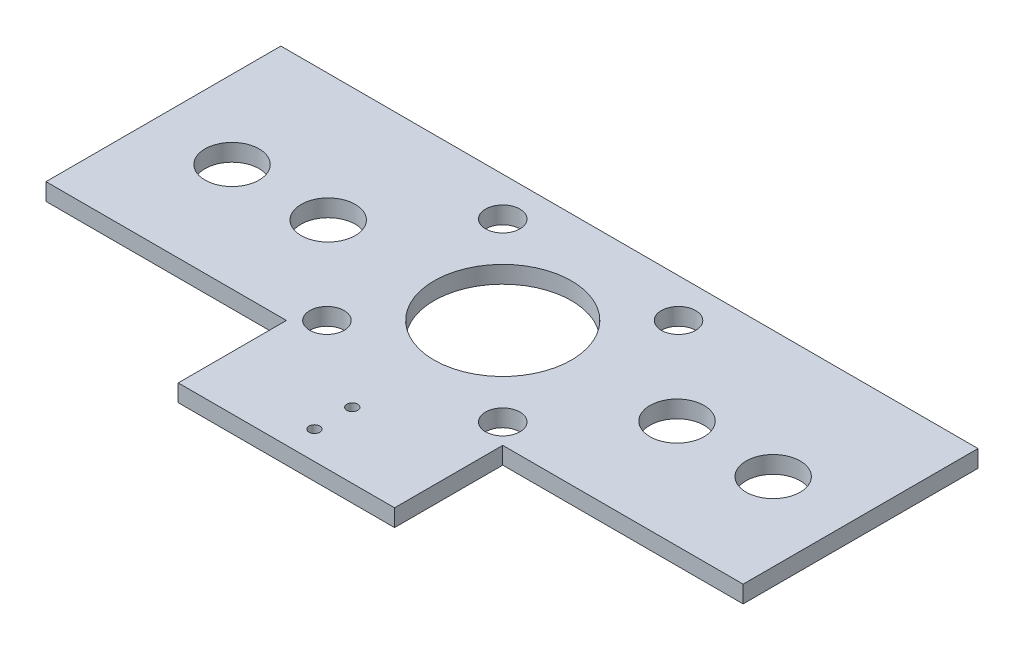
from build123d import *

# Parameters (mm, degrees)
PLATEOUTLINE_W      = 80
PLATEOUTLINE_H      = 40
BOSS_EXTRUDE1_DEPTH = 6.35
RAILGUIDES_R        = 6.35
CUT_EXTRUDE1_DEPTH  = 10
FUELGRAINMOUNTING_R = 25.4
CUT_EXTRUDE2_DEPTH  = 10
SKETCH2_R           = 2
CUT_EXTRUDE3_DEPTH  = 10
SKETCH5_R           = 10
CUT_EXTRUDE4_DEPTH  = 10


with BuildPart() as part:
    # plateOutline → Boss-Extrude1 (new body)
    with BuildSketch(Plane(origin=(0, 0, 0), x_dir=(1, 0, 0), z_dir=(0, 1, 0))):
        Polygon((-128.9, -40), (-40, -40), (40, -40), (128.9, -40), (128.9, 40), (128.9, 46.849926081), (-128.9, 46.849926081), (-128.9, 40), align=None)
        Polygon((-128.9, -40), (-40, -40), (40, -40), (128.9, -40), (128.9, 40), (128.9, 46.849926081), (-128.9, 46.849926081), (-128.9, 40), align=None)
        with Locations((0, -60)):
            Rectangle(PLATEOUTLINE_W, PLATEOUTLINE_H)
    extrude(amount=BOSS_EXTRUDE1_DEPTH)

    # railGuides → Cut-Extrude1 (cut)
    with BuildSketch(Plane(origin=(0, 0, 0), x_dir=(1, 0, 0), z_dir=(0, 1, 0))):
        with Locations((-32.5, 32.5)):
            Circle(RAILGUIDES_R)
        with Locations((32.5, 32.5)):
            Circle(RAILGUIDES_R)
        with Locations((32.5, -32.5)):
            Circle(RAILGUIDES_R)
        with Locations((-32.5, -32.5)):
            Circle(RAILGUIDES_R)
    extrude(amount=CUT_EXTRUDE1_DEPTH, mode=Mode.SUBTRACT)

    # FuelGrainMounting → Cut-Extrude2 (cut)
    with BuildSketch(Plane(origin=(0, 0, 0), x_dir=(1, 0, 0), z_dir=(0, 1, 0))):
        Circle(FUELGRAINMOUNTING_R)
    extrude(amount=CUT_EXTRUDE2_DEPTH, mode=Mode.SUBTRACT)

    # Sketch2 → Cut-Extrude3 (cut)
    with BuildSketch(Plane(origin=(0, 0, 0), x_dir=(1, 0, 0), z_dir=(0, 1, 0))):
        with Locations((0, -69.63)):
            Circle(SKETCH2_R)
        with Locations((0, -55.63)):
            Circle(SKETCH2_R)
    extrude(amount=CUT_EXTRUDE3_DEPTH, mode=Mode.SUBTRACT)

    # Sketch5 → Cut-Extrude4 (cut)
    with BuildSketch(Plane(origin=(0, 0, 0), x_dir=(1, 0, 0), z_dir=(0, 1, 0))):
        with Locations((-100, -0.097543847)):
            Circle(SKETCH5_R)
        with Locations((-64.45, -0.097543847)):
            Circle(SKETCH5_R)
        with Locations((64.45, 0)):
            Circle(SKETCH5_R)
        with Locations((100, 0)):
            Circle(SKETCH5_R)
    extrude(amount=CUT_EXTRUDE4_DEPTH, mode=Mode.SUBTRACT)


solid = part.part
